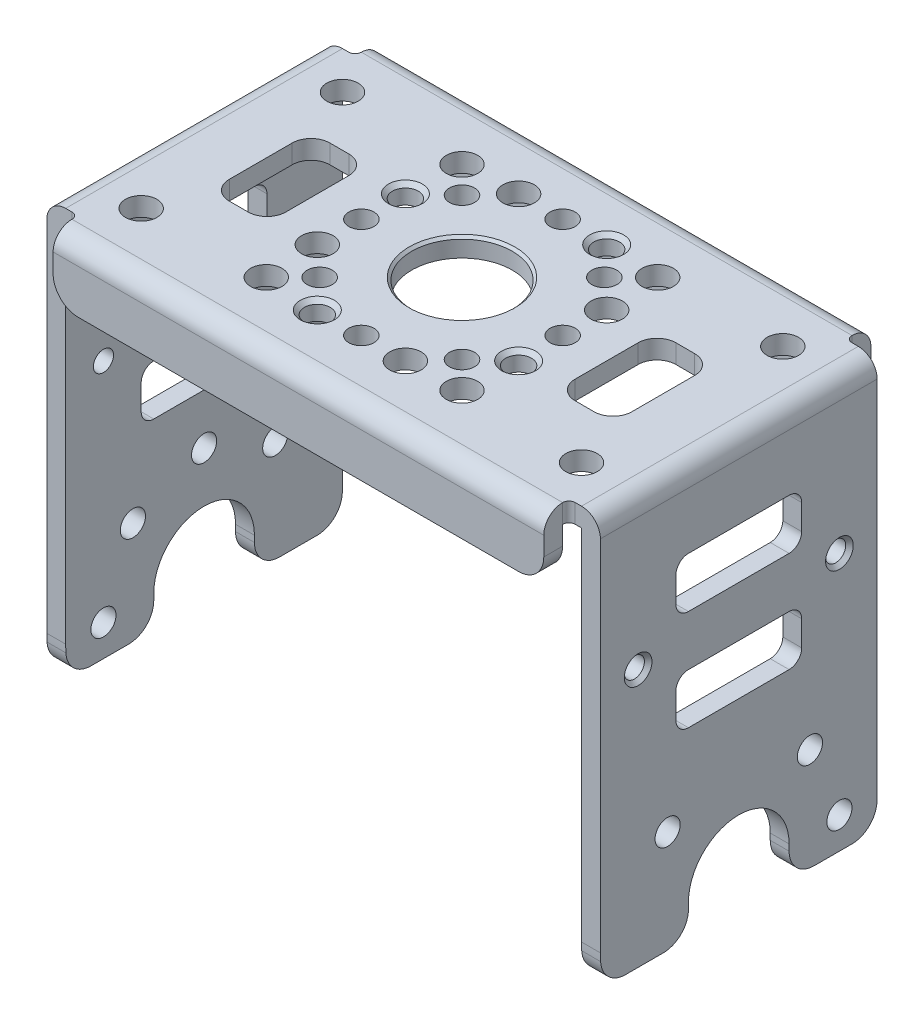
from build123d import *

# Parameters (mm, degrees)
CUT_EXTRUDE1_START     = -42.5
CUT_EXTRUDE1_OUTLINE_W = 22
CUT_EXTRUDE1_OUTLINE_H = 1.5
CUT_EXTRUDE1_DEPTH     = 44
CUT_EXTRUDE1_2_DEPTH   = 1.5
CUT_EXTRUDE1_3_DEPTH   = 1.5
SKETCH2_W              = 39
SKETCH2_H              = 1.5
BOSS_EXTRUDE1_DEPTH    = 2
SKETCH3_W              = 39
SKETCH3_H              = 1.5
BOSS_EXTRUDE2_DEPTH    = 3.5
SKETCH4_W              = 39
SKETCH4_H              = 1.5
BOSS_EXTRUDE3_DEPTH    = 2
SKETCH5_W              = 39
SKETCH5_H              = 1.5
BOSS_EXTRUDE4_DEPTH    = 3.5
CUT_EXTRUDE2_DEPTH     = 54.621357685
CUT_EXTRUDE3_DEPTH     = 54.621357685
SKETCH8_W              = 4.5
SKETCH8_H              = 8
CUT_EXTRUDE4_DEPTH     = 42.343076809
SKETCH9_W              = 10
SKETCH9_H              = 4
CUT_EXTRUDE5_DEPTH     = 54.621357685
SKETCH10_W             = 10
SKETCH10_H             = 4
CUT_EXTRUDE6_DEPTH     = 54.621357685
SKETCH11_W             = 10
SKETCH11_H             = 4
CUT_EXTRUDE7_DEPTH     = 54.621357685
SKETCH12_W             = 10
SKETCH12_H             = 4
CUT_EXTRUDE8_DEPTH     = 54.621357685
SKETCH13_W             = 4.5
SKETCH13_H             = 8
CUT_EXTRUDE9_DEPTH     = 41.174618853
HOLE1_D                = 2.5
CIRPATTERN1_COUNT      = 4
HOLE2_D                = 2.5
HOLE3_D                = 2.5
HOLE4_D                = 2.5
HOLE5_D                = 2.5
HOLE6_D                = 2.5
CIRPATTERN2_COUNT      = 4
HOLE7_D                = 2.05
HOLE7_DEPTH            = 32.5
CIRPATTERN3_COUNT      = 4
HOLE8_D                = 2
CIRPATTERN4_COUNT      = 8
HOLE9_D                = 8
HOLE9_DEPTH            = 32.5
HOLE10_D               = 2
HOLE10_DEPTH           = 1.5
HOLE11_D               = 2
HOLE11_DEPTH           = 1.5
CIRPATTERN5_COUNT      = 8
HOLE12_D               = 1.6
HOLE12_DEPTH           = 1.5
HOLE13_D               = 1.6
HOLE13_DEPTH           = 1.5
HOLE14_D               = 2
HOLE14_DEPTH           = 1.5
CIRPATTERN6_COUNT      = 8
HOLE15_D               = 2
HOLE16_D               = 1.6
HOLE16_DEPTH           = 44
HOLE17_D               = 1.6
HOLE17_DEPTH           = 44
CHAMFER1_SIZE          = 0.3
CHAMFER2_SIZE          = 0.325
CHAMFER3_SIZE          = 0.3
CHAMFER4_SIZE          = 0.325
CHAMFER5_SIZE          = 0.2
CHAMFER6_SIZE          = 0.325
CHAMFER7_SIZE          = 0.325
FILLET1_R              = 0.5
FILLET2_R              = 0.5
FILLET3_R              = 0.5
FILLET4_R              = 0.5
FILLET5_R              = 1
FILLET6_R              = 1
FILLET7_R              = 1
FILLET8_R              = 1
FILLET9_R              = 1
FILLET10_R             = 1
FILLET11_R             = 1
FILLET12_R             = 1
FILLET13_R             = 1
FILLET14_R             = 1
FILLET15_R             = 1
FILLET16_R             = 1
FILLET17_R             = 1
FILLET18_R             = 1
FILLET19_R             = 1
FILLET20_R             = 1
FILLET21_R             = 1.5
FILLET22_R             = 1.5
FILLET23_R             = 1.5
FILLET24_R             = 1.5
FILLET25_R             = 1.5
FILLET26_R             = 1.5
FILLET27_R             = 1.5
FILLET28_R             = 1.5
FILLET29_R             = 1.5
FILLET30_R             = 1.5
FILLET31_R             = 1.5
FILLET32_R             = 1.5
FILLET33_R             = 2
FILLET34_R             = 2
FILLET35_R             = 2
FILLET36_R             = 2
FILLET37_R             = 2
FILLET38_R             = 2
FILLET39_R             = 2
FILLET40_R             = 2
FILLET41_R             = 2
FILLET42_R             = 2
FILLET43_R             = 2
FILLET44_R             = 2


with BuildPart() as part:
    # Cut-Extrude1: read off the stored shape, not the designer's step
    # Cut-Extrude1 outline → Cut-Extrude1 (new body)
    with BuildSketch(Plane(origin=(20.5, 0, 0), x_dir=(0, 0, -1), z_dir=(1, 0, 0)).offset(CUT_EXTRUDE1_START)):
        with Locations((0, 29.25)):
            Rectangle(CUT_EXTRUDE1_OUTLINE_W, CUT_EXTRUDE1_OUTLINE_H)
    extrude(amount=CUT_EXTRUDE1_DEPTH)

    # Cut-Extrude1 2 outline → Cut-Extrude1 2 (add)
    with BuildSketch(Plane(origin=(20.5, 0, 0), x_dir=(0, 0, -1), z_dir=(1, 0, 0)).offset(CUT_EXTRUDE1_START)):
        with BuildLine():
            Line((-11, 28.5), (-11, 0))
            ThreePointArc((-11, 0), (-10.927798705, -1.258258902), (-10.712142643, -2.5))
            Line((-10.712142643, -2.5), (10.712142643, -2.5))
            ThreePointArc((10.712142643, -2.5), (10.927798705, -1.258258902), (11, 0))
            Line((11, 0), (11, 28.5))
            Line((11, 28.5), (-11, 28.5))
        make_face()
    extrude(amount=CUT_EXTRUDE1_2_DEPTH)

    # Cut-Extrude1 3 outline → Cut-Extrude1 3 (add)
    with BuildSketch(Plane(origin=(20.5, 0, 0), x_dir=(0, 0, -1), z_dir=(1, 0, 0))):
        with BuildLine():
            Line((-11, 28.5), (-11, 0))
            ThreePointArc((-11, 0), (-10.927798705, -1.258258902), (-10.712142643, -2.5))
            Line((-10.712142643, -2.5), (10.712142643, -2.5))
            ThreePointArc((10.712142643, -2.5), (10.927798705, -1.258258902), (11, 0))
            Line((11, 0), (11, 28.5))
            Line((11, 28.5), (-11, 28.5))
        make_face()
    extrude(amount=CUT_EXTRUDE1_3_DEPTH)

    # Sketch2 → Boss-Extrude1 (add)
    with BuildSketch(Plane(origin=(0, 0, -11), x_dir=(-1, 0, 0), z_dir=(0, 0, -1))):
        with Locations((0, 29.25)):
            Rectangle(SKETCH2_W, SKETCH2_H)
    extrude(amount=BOSS_EXTRUDE1_DEPTH)

    # Sketch3 → Boss-Extrude2 (add)
    with BuildSketch(Plane.XZ.offset(-28.5)):
        with Locations((0, -12.25)):
            Rectangle(SKETCH3_W, SKETCH3_H)
    extrude(amount=BOSS_EXTRUDE2_DEPTH)

    # Sketch4 → Boss-Extrude3 (add)
    with BuildSketch(Plane.XY.offset(11)):
        with Locations((0, 29.25)):
            Rectangle(SKETCH4_W, SKETCH4_H)
    extrude(amount=BOSS_EXTRUDE3_DEPTH)

    # Sketch5 → Boss-Extrude4 (add)
    with BuildSketch(Plane.XZ.offset(-28.5)):
        with Locations((0, 12.25)):
            Rectangle(SKETCH5_W, SKETCH5_H)
    extrude(amount=BOSS_EXTRUDE4_DEPTH)

    # Sketch6 → Cut-Extrude2 (cut, through all)
    with BuildSketch(Plane.ZY.offset(-20.5)):
        with BuildLine():
            Line((4, -2.5), (4, 0))
            ThreePointArc((4, 0), (0, 4), (-4, 0))
            Line((-4, 0), (-4, -2.5))
            Line((-4, -2.5), (4, -2.5))
        make_face()
    extrude(amount=-CUT_EXTRUDE2_DEPTH, mode=Mode.SUBTRACT)

    # Sketch7 → Cut-Extrude3 (cut, through all)
    with BuildSketch(Plane(origin=(-20.5, 0, 0), x_dir=(0, 0, -1), z_dir=(1, 0, 0))):
        with BuildLine():
            Line((4, -2.5), (4, 0))
            ThreePointArc((4, 0), (0, 4), (-4, 0))
            Line((-4, 0), (-4, -2.5))
            Line((-4, -2.5), (4, -2.5))
        make_face()
    extrude(amount=-CUT_EXTRUDE3_DEPTH, mode=Mode.SUBTRACT)

    # Sketch8 → Cut-Extrude4 (cut, through all)
    with BuildSketch(Plane(origin=(0, 30, 0), x_dir=(-1, 0, 0), z_dir=(0, 1, 0))):
        with Locations((-13.75, 0)):
            Rectangle(SKETCH8_W, SKETCH8_H)
    extrude(amount=-CUT_EXTRUDE4_DEPTH, mode=Mode.SUBTRACT)

    # Sketch9 → Cut-Extrude5 (cut, through all)
    with BuildSketch(Plane.ZY.offset(-20.5)):
        with Locations((0, 22)):
            Rectangle(SKETCH9_W, SKETCH9_H)
    extrude(amount=-CUT_EXTRUDE5_DEPTH, mode=Mode.SUBTRACT)

    # Sketch10 → Cut-Extrude6 (cut, through all)
    with BuildSketch(Plane.ZY.offset(-20.5)):
        with Locations((0, 14)):
            Rectangle(SKETCH10_W, SKETCH10_H)
    extrude(amount=-CUT_EXTRUDE6_DEPTH, mode=Mode.SUBTRACT)

    # Sketch11 → Cut-Extrude7 (cut, through all)
    with BuildSketch(Plane(origin=(-20.5, 0, 0), x_dir=(0, 0, -1), z_dir=(1, 0, 0))):
        with Locations((0, 22)):
            Rectangle(SKETCH11_W, SKETCH11_H)
    extrude(amount=-CUT_EXTRUDE7_DEPTH, mode=Mode.SUBTRACT)

    # Sketch12 → Cut-Extrude8 (cut, through all)
    with BuildSketch(Plane(origin=(-20.5, 0, 0), x_dir=(0, 0, -1), z_dir=(1, 0, 0))):
        with Locations((0, 14)):
            Rectangle(SKETCH12_W, SKETCH12_H)
    extrude(amount=-CUT_EXTRUDE8_DEPTH, mode=Mode.SUBTRACT)

    # Sketch13 → Cut-Extrude9 (cut, through all)
    with BuildSketch(Plane.XZ.offset(-28.5)):
        with Locations((-13.75, 0)):
            Rectangle(SKETCH13_W, SKETCH13_H)
    extrude(amount=-CUT_EXTRUDE9_DEPTH, mode=Mode.SUBTRACT)

    # Hole1 (through all)
    with Locations(Plane.XZ.offset(-28.5)):
        with Locations((-7.778174593, -7.778174593)):
            hole1 = Hole(HOLE1_D / 2)

    # CirPattern1: Hole1 ×4 about axis
    cirpattern1_axis = Axis((0, 0, 0), (0, 1, 0))
    for i in range(1, CIRPATTERN1_COUNT):
        add(hole1.rotate(cirpattern1_axis, i * 360 / CIRPATTERN1_COUNT), mode=Mode.SUBTRACT)

    # Hole2 (through all)
    with Locations(Plane.XZ.offset(-28.5)):
        with Locations((-17.5, 8)):
            Hole(HOLE2_D / 2)

    # Hole3 (through all)
    with Locations(Plane.XZ.offset(-28.5)):
        with Locations((-17.5, -8)):
            Hole(HOLE3_D / 2)

    # Hole4 (through all)
    with Locations(Plane.XZ.offset(-28.5)):
        with Locations((17.5, 8)):
            Hole(HOLE4_D / 2)

    # Hole5 (through all)
    with Locations(Plane.XZ.offset(-28.5)):
        with Locations((17.5, -8)):
            Hole(HOLE5_D / 2)

    # Hole6 (through all)
    with Locations(Plane.XZ.offset(-28.5)):
        with Locations((8, -3.5)):
            hole6 = Hole(HOLE6_D / 2)

    # CirPattern2: Hole6 ×4 about axis
    cirpattern2_axis = Axis((0, 0, 0), (0, 1, 0))
    for i in range(1, CIRPATTERN2_COUNT):
        add(hole6.rotate(cirpattern2_axis, i * 360 / CIRPATTERN2_COUNT), mode=Mode.SUBTRACT)

    # Hole7
    with Locations(Plane(origin=(0, 30, 0), x_dir=(-1, 0, 0), z_dir=(0, 1, 0))):
        with Locations((-3.5, -8)):
            hole7 = Hole(HOLE7_D / 2, depth=HOLE7_DEPTH)

    # CirPattern3: Hole7 ×4 about axis
    cirpattern3_axis = Axis((0, 0, 0), (0, 1, 0))
    for i in range(1, CIRPATTERN3_COUNT):
        add(hole7.rotate(cirpattern3_axis, i * 360 / CIRPATTERN3_COUNT), mode=Mode.SUBTRACT)

    # Hole8 (through all)
    with Locations(Plane.XZ.offset(-28.5)):
        with Locations((-8, 0)):
            hole8 = Hole(HOLE8_D / 2)

    # CirPattern4: Hole8 ×8 about axis
    cirpattern4_axis = Axis((0, 0, 0), (0, 1, 0))
    for i in range(1, CIRPATTERN4_COUNT):
        add(hole8.rotate(cirpattern4_axis, i * 360 / CIRPATTERN4_COUNT), mode=Mode.SUBTRACT)

    # Hole9
    with Locations(Plane(origin=(0, 30, 0), x_dir=(-1, 0, 0), z_dir=(0, 1, 0))):
        with Locations((0, 0)):
            Hole(HOLE9_D / 2, depth=HOLE9_DEPTH)

    # Hole10
    with Locations(Plane(origin=(-20.5, 0, 0), x_dir=(0, 0, -1), z_dir=(1, 0, 0))):
        with Locations((5.656854249, 5.656854249)):
            Hole(HOLE10_D / 2, depth=HOLE10_DEPTH)

    # Hole11
    with Locations(Plane(origin=(-20.5, 0, 0), x_dir=(0, 0, -1), z_dir=(1, 0, 0))):
        with Locations((-8, 0)):
            hole11 = Hole(HOLE11_D / 2, depth=HOLE11_DEPTH)

    # CirPattern5: Hole11 ×8 about axis, 4 skipped
    cirpattern5_axis = Axis((-121.25, 0, 0), (1, 0, 0))
    add([hole11.rotate(cirpattern5_axis, i * 360 / CIRPATTERN5_COUNT) for i in range(1, CIRPATTERN5_COUNT) if i not in (1, 2, 3, 4)], mode=Mode.SUBTRACT)

    # Hole12
    with Locations(Plane(origin=(-20.5, 0, 0), x_dir=(0, 0, -1), z_dir=(1, 0, 0))):
        with Locations((-8, 18)):
            Hole(HOLE12_D / 2, depth=HOLE12_DEPTH)

    # Hole13
    with Locations(Plane(origin=(-20.5, 0, 0), x_dir=(0, 0, -1), z_dir=(1, 0, 0))):
        with Locations((8, 18)):
            Hole(HOLE13_D / 2, depth=HOLE13_DEPTH)

    # Hole14
    with Locations(Plane.ZY.offset(-20.5)):
        with Locations((-8, 0)):
            hole14 = Hole(HOLE14_D / 2, depth=HOLE14_DEPTH)

    # CirPattern6: Hole14 ×8 about axis, 6 skipped
    cirpattern6_axis = Axis((-78.75, 0, 0), (1, 0, 0))
    add([hole14.rotate(cirpattern6_axis, i * 360 / CIRPATTERN6_COUNT) for i in range(1, CIRPATTERN6_COUNT) if i not in (1, 2, 4, 5, 6, 7)], mode=Mode.SUBTRACT)

    # Hole15 (through all)
    with Locations(Plane.ZY.offset(-20.5)):
        with Locations((-5.656854249, 5.656854249)):
            Hole(HOLE15_D / 2)

    # Hole16
    with Locations(Plane(origin=(22, 0, 0), x_dir=(0, 0, -1), z_dir=(1, 0, 0))):
        with Locations((-8, 18)):
            Hole(HOLE16_D / 2, depth=HOLE16_DEPTH)

    # Hole17
    with Locations(Plane(origin=(22, 0, 0), x_dir=(0, 0, -1), z_dir=(1, 0, 0))):
        with Locations((8, 18)):
            Hole(HOLE17_D / 2, depth=HOLE17_DEPTH)

    # Chamfer1
    chamfer1_edges = [part.edges().sort_by_distance(p)[0] for p in [
        (22, 18, -8.8),
    ]]
    chamfer(chamfer1_edges, length=CHAMFER1_SIZE)

    # Chamfer2
    chamfer2_edges = [part.edges().sort_by_distance(p)[0] for p in [
        (8, 30, 2.475),
    ]]
    chamfer(chamfer2_edges, length=CHAMFER2_SIZE)

    # Chamfer3
    chamfer3_edges = [part.edges().sort_by_distance(p)[0] for p in [
        (22, 18, 7.2),
    ]]
    chamfer(chamfer3_edges, length=CHAMFER3_SIZE)

    # Chamfer4
    chamfer4_edges = [part.edges().sort_by_distance(p)[0] for p in [
        (-2.475, 30, 8),
    ]]
    chamfer(chamfer4_edges, length=CHAMFER4_SIZE)

    # Chamfer5
    chamfer5_edges = [part.edges().sort_by_distance(p)[0] for p in [
        (-4, 30, 0),
    ]]
    chamfer(chamfer5_edges, length=CHAMFER5_SIZE)

    # Chamfer6
    chamfer6_edges = [part.edges().sort_by_distance(p)[0] for p in [
        (2.475, 30, -8),
    ]]
    chamfer(chamfer6_edges, length=CHAMFER6_SIZE)

    # Chamfer7
    chamfer7_edges = [part.edges().sort_by_distance(p)[0] for p in [
        (-8, 30, -2.475),
    ]]
    chamfer(chamfer7_edges, length=CHAMFER7_SIZE)

    # Fillet1
    fillet1_edges = [part.edges().sort_by_distance(p)[0] for p in [
        (19.5, 29.25, 11),
    ]]
    fillet(fillet1_edges, radius=FILLET1_R)

    # Fillet2
    fillet2_edges = [part.edges().sort_by_distance(p)[0] for p in [
        (19.5, 29.25, -11),
    ]]
    fillet(fillet2_edges, radius=FILLET2_R)

    # Fillet3
    fillet3_edges = [part.edges().sort_by_distance(p)[0] for p in [
        (-19.5, 29.25, 11),
    ]]
    fillet(fillet3_edges, radius=FILLET3_R)

    # Fillet4
    fillet4_edges = [part.edges().sort_by_distance(p)[0] for p in [
        (-19.5, 29.25, -11),
    ]]
    fillet(fillet4_edges, radius=FILLET4_R)

    # Fillet5
    fillet5_edges = [part.edges().sort_by_distance(p)[0] for p in [
        (21.25, 12, 5),
    ]]
    fillet(fillet5_edges, radius=FILLET5_R)

    # Fillet6
    fillet6_edges = [part.edges().sort_by_distance(p)[0] for p in [
        (21.25, 20, -5),
    ]]
    fillet(fillet6_edges, radius=FILLET6_R)

    # Fillet7
    fillet7_edges = [part.edges().sort_by_distance(p)[0] for p in [
        (21.25, 20, 5),
    ]]
    fillet(fillet7_edges, radius=FILLET7_R)

    # Fillet8
    fillet8_edges = [part.edges().sort_by_distance(p)[0] for p in [
        (-21.25, 24, 5),
    ]]
    fillet(fillet8_edges, radius=FILLET8_R)

    # Fillet9
    fillet9_edges = [part.edges().sort_by_distance(p)[0] for p in [
        (-21.25, 20, 5),
    ]]
    fillet(fillet9_edges, radius=FILLET9_R)

    # Fillet10
    fillet10_edges = [part.edges().sort_by_distance(p)[0] for p in [
        (21.25, 12, -5),
    ]]
    fillet(fillet10_edges, radius=FILLET10_R)

    # Fillet11
    fillet11_edges = [part.edges().sort_by_distance(p)[0] for p in [
        (-21.25, 20, -5),
    ]]
    fillet(fillet11_edges, radius=FILLET11_R)

    # Fillet12
    fillet12_edges = [part.edges().sort_by_distance(p)[0] for p in [
        (21.25, 16, -5),
    ]]
    fillet(fillet12_edges, radius=FILLET12_R)

    # Fillet13
    fillet13_edges = [part.edges().sort_by_distance(p)[0] for p in [
        (-21.25, 16, -5),
    ]]
    fillet(fillet13_edges, radius=FILLET13_R)

    # Fillet14
    fillet14_edges = [part.edges().sort_by_distance(p)[0] for p in [
        (21.25, 24, -5),
    ]]
    fillet(fillet14_edges, radius=FILLET14_R)

    # Fillet15
    fillet15_edges = [part.edges().sort_by_distance(p)[0] for p in [
        (-21.25, 16, 5),
    ]]
    fillet(fillet15_edges, radius=FILLET15_R)

    # Fillet16
    fillet16_edges = [part.edges().sort_by_distance(p)[0] for p in [
        (-21.25, 12, -5),
    ]]
    fillet(fillet16_edges, radius=FILLET16_R)

    # Fillet17
    fillet17_edges = [part.edges().sort_by_distance(p)[0] for p in [
        (-21.25, 12, 5),
    ]]
    fillet(fillet17_edges, radius=FILLET17_R)

    # Fillet18
    fillet18_edges = [part.edges().sort_by_distance(p)[0] for p in [
        (21.25, 24, 5),
    ]]
    fillet(fillet18_edges, radius=FILLET18_R)

    # Fillet19
    fillet19_edges = [part.edges().sort_by_distance(p)[0] for p in [
        (21.25, 16, 5),
    ]]
    fillet(fillet19_edges, radius=FILLET19_R)

    # Fillet20
    fillet20_edges = [part.edges().sort_by_distance(p)[0] for p in [
        (-21.25, 24, -5),
    ]]
    fillet(fillet20_edges, radius=FILLET20_R)

    # Fillet21
    fillet21_edges = [part.edges().sort_by_distance(p)[0] for p in [
        (11.5, 29.25, -4),
    ]]
    fillet(fillet21_edges, radius=FILLET21_R)

    # Fillet22
    fillet22_edges = [part.edges().sort_by_distance(p)[0] for p in [
        (0, 30, -13),
    ]]
    fillet(fillet22_edges, radius=FILLET22_R)

    # Fillet23
    fillet23_edges = [part.edges().sort_by_distance(p)[0] for p in [
        (16, 29.25, 4),
    ]]
    fillet(fillet23_edges, radius=FILLET23_R)

    # Fillet24
    fillet24_edges = [part.edges().sort_by_distance(p)[0] for p in [
        (-11.5, 29.25, 4),
    ]]
    fillet(fillet24_edges, radius=FILLET24_R)

    # Fillet25
    fillet25_edges = [part.edges().sort_by_distance(p)[0] for p in [
        (-22, 30, 0),
    ]]
    fillet(fillet25_edges, radius=FILLET25_R)

    # Fillet26
    fillet26_edges = [part.edges().sort_by_distance(p)[0] for p in [
        (-16, 29.25, -4),
    ]]
    fillet(fillet26_edges, radius=FILLET26_R)

    # Fillet27
    fillet27_edges = [part.edges().sort_by_distance(p)[0] for p in [
        (0, 30, 13),
    ]]
    fillet(fillet27_edges, radius=FILLET27_R)

    # Fillet28
    fillet28_edges = [part.edges().sort_by_distance(p)[0] for p in [
        (16, 29.25, -4),
    ]]
    fillet(fillet28_edges, radius=FILLET28_R)

    # Fillet29
    fillet29_edges = [part.edges().sort_by_distance(p)[0] for p in [
        (22, 30, 0),
    ]]
    fillet(fillet29_edges, radius=FILLET29_R)

    # Fillet30
    fillet30_edges = [part.edges().sort_by_distance(p)[0] for p in [
        (-16, 29.25, 4),
    ]]
    fillet(fillet30_edges, radius=FILLET30_R)

    # Fillet31
    fillet31_edges = [part.edges().sort_by_distance(p)[0] for p in [
        (11.5, 29.25, 4),
    ]]
    fillet(fillet31_edges, radius=FILLET31_R)

    # Fillet32
    fillet32_edges = [part.edges().sort_by_distance(p)[0] for p in [
        (-11.5, 29.25, -4),
    ]]
    fillet(fillet32_edges, radius=FILLET32_R)

    # Fillet33
    fillet33_edges = [part.edges().sort_by_distance(p)[0] for p in [
        (21.25, -2.5, 4),
    ]]
    fillet(fillet33_edges, radius=FILLET33_R)

    # Fillet34
    fillet34_edges = [part.edges().sort_by_distance(p)[0] for p in [
        (21.25, -2.5, -10.712142643),
    ]]
    fillet(fillet34_edges, radius=FILLET34_R)

    # Fillet35
    fillet35_edges = [part.edges().sort_by_distance(p)[0] for p in [
        (19.5, 25, -12.25),
    ]]
    fillet(fillet35_edges, radius=FILLET35_R)

    # Fillet36
    fillet36_edges = [part.edges().sort_by_distance(p)[0] for p in [
        (-21.25, -2.5, -4),
    ]]
    fillet(fillet36_edges, radius=FILLET36_R)

    # Fillet37
    fillet37_edges = [part.edges().sort_by_distance(p)[0] for p in [
        (-19.5, 25, -12.25),
    ]]
    fillet(fillet37_edges, radius=FILLET37_R)

    # Fillet38
    fillet38_edges = [part.edges().sort_by_distance(p)[0] for p in [
        (-21.25, -2.5, 10.712142643),
    ]]
    fillet(fillet38_edges, radius=FILLET38_R)

    # Fillet39
    fillet39_edges = [part.edges().sort_by_distance(p)[0] for p in [
        (-21.25, -2.5, 4),
    ]]
    fillet(fillet39_edges, radius=FILLET39_R)

    # Fillet40
    fillet40_edges = [part.edges().sort_by_distance(p)[0] for p in [
        (19.5, 25, 12.25),
    ]]
    fillet(fillet40_edges, radius=FILLET40_R)

    # Fillet41
    fillet41_edges = [part.edges().sort_by_distance(p)[0] for p in [
        (-19.5, 25, 12.25),
    ]]
    fillet(fillet41_edges, radius=FILLET41_R)

    # Fillet42
    fillet42_edges = [part.edges().sort_by_distance(p)[0] for p in [
        (21.25, -2.5, -4),
    ]]
    fillet(fillet42_edges, radius=FILLET42_R)

    # Fillet43
    fillet43_edges = [part.edges().sort_by_distance(p)[0] for p in [
        (21.25, -2.5, 10.712142643),
    ]]
    fillet(fillet43_edges, radius=FILLET43_R)

    # Fillet44
    fillet44_edges = [part.edges().sort_by_distance(p)[0] for p in [
        (-21.25, -2.5, -10.712142643),
    ]]
    fillet(fillet44_edges, radius=FILLET44_R)


solid = part.part
